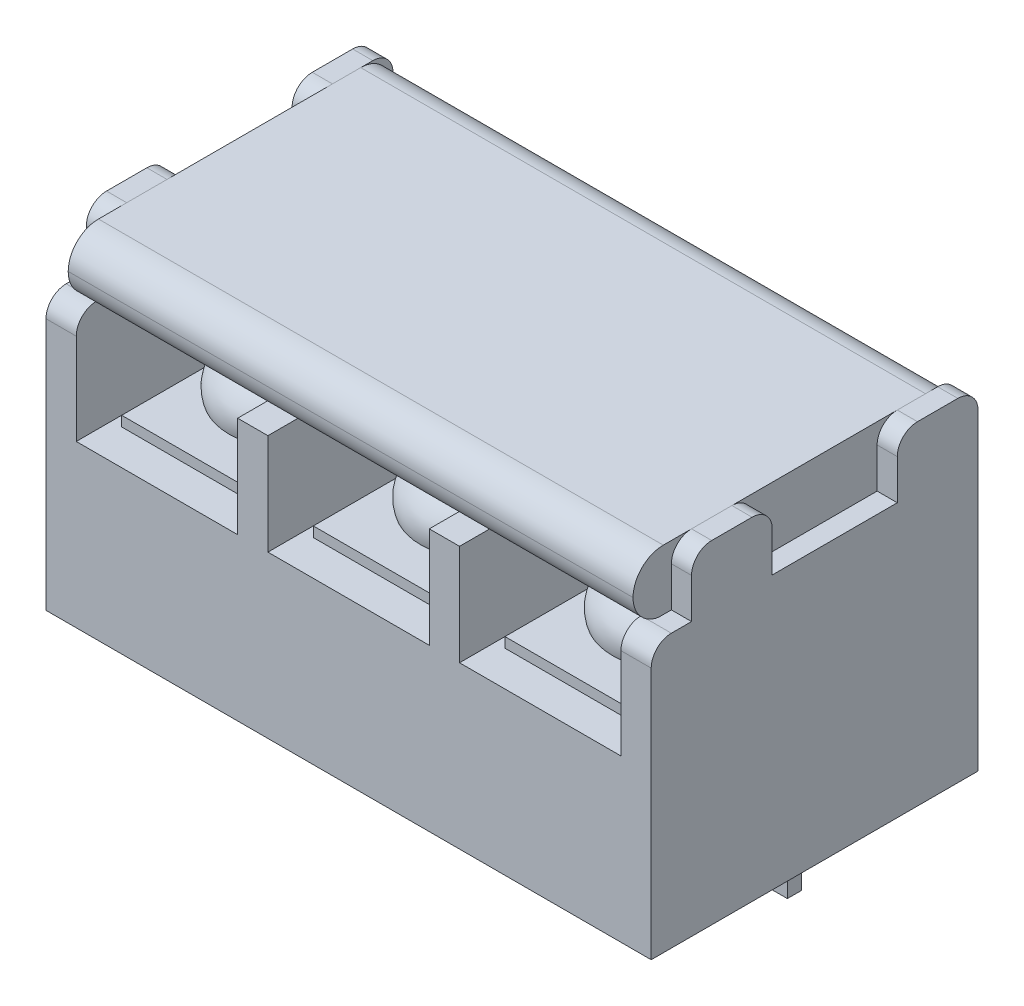
from build123d import *

# Parameters (mm, degrees)
SKETCH_1_W               = 30
SKETCH_1_H               = 16.2
EXTRUDE_1_DEPTH          = 16.5
SKETCH_2_W               = 8
SKETCH_2_H               = 8.5
CUT_EXTRUDE_1_DEPTH      = 13.5
SKETCH_3_W               = 8
SKETCH_3_H               = 11.5
CUT_EXTRUDE_2_DEPTH      = 1
CUT_EXTRUDE_3_DEPTH      = 27.067220795
CUT_EXTRUDE_3_DEPTH_BACK = 27.067220795
SKETCH_4_W               = 27
SKETCH_4_H               = 3.5
SKETCH_5_W               = 6.2
SKETCH_5_H               = 2.980437285
SKETCH_5_W_2             = 2
CUT_EXTRUDE_4_DEPTH      = 36.183234644
SKETCH_12_W              = 28
SKETCH_12_H              = 2.980437285
CUT_EXTRUDE_6_DEPTH      = 28.56247449
SKETCH_10_W              = 16
SKETCH_10_H              = 3
EXTRUDE_3_DEPTH          = 14
FILLET_2_R               = 1
FILLET_1_R               = 1.5
SKETCH_6_W               = 7
SKETCH_6_H               = 10
EXTRUDE_2_DEPTH          = 0.5
SKETCH_9_W               = 7
SKETCH_9_H               = 1.2
SKETCH_9_W_2             = 1.2
SKETCH_9_H_2             = 4
CUT_EXTRUDE_5_DEPTH      = 1.5
SKETCH_11_W              = 1.5
SKETCH_11_H              = 0.7
EXTRUDE_4_DEPTH          = 5.5
PATTERN_LINEAR_5_COUNT   = 3
PATTERN_LINEAR_5_PITCH   = 9.5
FILLET_3_R               = 1


with BuildPart() as part:
    # 草图1 → 凸台-拉伸1 (new body)
    with BuildSketch(Plane(origin=(0, 0, 0), x_dir=(1, 0, 0), z_dir=(0, 1, 0))):
        Rectangle(SKETCH_1_W, SKETCH_1_H)
    extrude(amount=EXTRUDE_1_DEPTH)

    # 草图2 → 切除-拉伸1 (cut)
    with BuildSketch(Plane.XY.offset(8.1)):
        with Locations((-9.5, 12.25)):
            Rectangle(SKETCH_2_W, SKETCH_2_H)
        with Locations((0, 12.25)):
            Rectangle(SKETCH_2_W, SKETCH_2_H)
        with Locations((9.5, 12.25)):
            Rectangle(SKETCH_2_W, SKETCH_2_H)
    extrude(amount=-CUT_EXTRUDE_1_DEPTH, mode=Mode.SUBTRACT)

    # 草图3 → 切除-拉伸2 (cut)
    with BuildSketch(Plane(origin=(0, 0, -8.1), x_dir=(-1, 0, 0), z_dir=(0, 0, -1))):
        with Locations((-9.5, 5.75)):
            Rectangle(SKETCH_3_W, SKETCH_3_H)
        with Locations((0, 5.75)):
            Rectangle(SKETCH_3_W, SKETCH_3_H)
        with Locations((9.5, 5.75)):
            Rectangle(SKETCH_3_W, SKETCH_3_H)
    extrude(amount=-CUT_EXTRUDE_2_DEPTH, mode=Mode.SUBTRACT)

    # 草图4 → 切除-拉伸3 (cut, two sides: drawn at the far end of the back side and taken through both)
    with BuildSketch(Plane.XY.offset(-5.4).offset(-CUT_EXTRUDE_3_DEPTH_BACK)):
        with Locations((0, 14.75)):
            Rectangle(SKETCH_4_W, SKETCH_4_H)
    extrude(amount=CUT_EXTRUDE_3_DEPTH + CUT_EXTRUDE_3_DEPTH_BACK, mode=Mode.SUBTRACT)

    # 草图5 → 切除-拉伸4 (cut, through all)
    with BuildSketch(Plane.ZY.offset(15)):
        with Locations((-1, 15.009781357)):
            Rectangle(SKETCH_5_W, SKETCH_5_H)
        with Locations((7.1, 15.009781357)):
            Rectangle(SKETCH_5_W_2, SKETCH_5_H)
    extrude(amount=-CUT_EXTRUDE_4_DEPTH, mode=Mode.SUBTRACT)

    # 草图12 → 切除-拉伸6 (cut, through all)
    with BuildSketch(Plane.XY.offset(8.1)):
        with Locations((0, 15.009781357)):
            Rectangle(SKETCH_12_W, SKETCH_12_H)
    extrude(amount=-CUT_EXTRUDE_6_DEPTH, mode=Mode.SUBTRACT)

    # 圆角2
    fillet_2_edges = [part.edges().sort_by_distance(p)[0] for p in [
        (-14.25, 13.519562715, 8.1),
        (14.25, 13.519562715, 8.1),
    ]]
    fillet(fillet_2_edges, radius=FILLET_2_R)



with BuildPart() as body_2:
    # 草图10 → 凸台-拉伸3 (new, symmetric)
    with BuildSketch(Plane(origin=(0, 0, 0), x_dir=(0, 0, -1), z_dir=(1, 0, 0))):
        with Locations((0, 15)):
            Rectangle(SKETCH_10_W, SKETCH_10_H)
    extrude(amount=EXTRUDE_3_DEPTH, both=True)

    # 圆角1
    fillet_1_edges = [body_2.edges().sort_by_distance(p)[0] for p in [
        (0, 13.5, -8),
        (0, 16.5, -8),
        (0, 13.5, 8),
        (0, 16.5, 8),
    ]]
    fillet(fillet_1_edges, radius=FILLET_1_R - 0.0001)  # a hair under: the kernel refuses the full size


with BuildPart() as body_3:
    # 草图6 → 凸台-拉伸2 (new body)
    with BuildSketch(Plane(origin=(0, 8, 0), x_dir=(1, 0, 0), z_dir=(0, 1, 0))):
        with Locations((-9.5, -1.35)):
            Rectangle(SKETCH_6_W, SKETCH_6_H)
    extrude_2 = extrude(amount=EXTRUDE_2_DEPTH)


with BuildPart() as part_1:
    add(part.part)

    add(body_3.part)  # 旋转1 merges body 3
    # 草图8 → 旋转1 (revolve)
    with BuildSketch(Plane.XY.offset(1.35), mode=Mode.PRIVATE) as revolve_1_sk:
        with BuildLine():
            Line((-7.83, 10.55), (-9.5, 10.55))
            Line((-9.5, 10.55), (-9.5, 8.5))
            Line((-9.5, 8.5), (-6.348953073, 8.5))
            ThreePointArc((-6.348953073, 8.5), (-6.565484282, 9.903564448), (-7.83, 10.55))
        make_face()
    revolve_1 = revolve(revolve_1_sk.sketch.rotate(Axis((-9.5, 8.5, 1.35), (0, 1, 0)), 90), axis=Axis((-9.5, 8.5, 1.35), (0, 1, 0)))

    # 草图9 → 切除-拉伸5 (cut)
    with BuildSketch(Plane(origin=(0, 10.55, 0), x_dir=(1, 0, 0), z_dir=(0, 1, 0))):
        with Locations((-9.5, -1.35)):
            Rectangle(SKETCH_9_W, SKETCH_9_H)
        with Locations((-9.5, -1.35)):
            Rectangle(SKETCH_9_W_2, SKETCH_9_H_2)
    cut_extrude_5 = extrude(amount=-CUT_EXTRUDE_5_DEPTH, mode=Mode.SUBTRACT)

    # 草图11 → 凸台-拉伸4 (add)
    with BuildSketch(Plane.XZ):
        with Locations((-9.5, -3.75)):
            Rectangle(SKETCH_11_W, SKETCH_11_H)
    extrude_4 = extrude(amount=EXTRUDE_4_DEPTH)

    # 阵列(线性)5: 凸台-拉伸2, 旋转1, 切除-拉伸5, 凸台-拉伸4 ×3
    with Locations(*[(i * PATTERN_LINEAR_5_PITCH, 0, 0) for i in range(1, PATTERN_LINEAR_5_COUNT)]):
        add(extrude_2)
        add(revolve_1)
        add(cut_extrude_5, mode=Mode.SUBTRACT)
        add(extrude_4)

    # 圆角3
    fillet_3_edges = [part_1.edges().sort_by_distance(p)[0] for p in [
        (14.5, 16.5, -4.1),
        (14.5, 16.5, 2.1),
        (14.5, 16.5, 6.1),
        (-14.5, 16.5, 6.1),
        (-14.5, 16.5, 2.1),
        (-14.5, 16.5, -4.1),
        (-14.5, 16.5, -8.1),
        (14.5, 16.5, -8.1),
    ]]
    fillet(fillet_3_edges, radius=FILLET_3_R)


solid = Compound([body_2.part, part_1.part])
